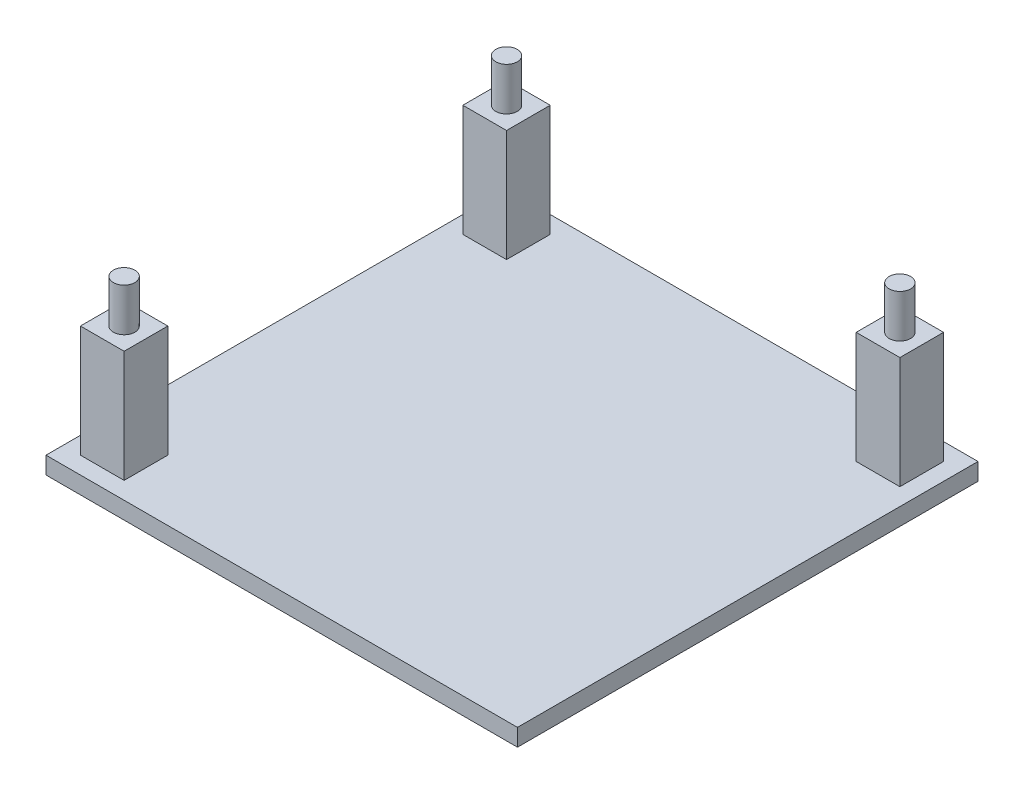
from build123d import *

# Parameters (mm, degrees)
SKETCH2_W           = 54.8
SKETCH2_H           = 53.53
BOSS_EXTRUDE1_DEPTH = 2
SKETCH3_W           = 5.08
SKETCH3_H           = 5.08
BOSS_EXTRUDE2_DEPTH = 13
SKETCH6_R           = 1.25
BOSS_EXTRUDE3_DEPTH = 5


with BuildPart() as part:
    # Sketch2 → Boss-Extrude1 (new body)
    with BuildSketch(Plane(origin=(0, 0, 0), x_dir=(1, 0, 0), z_dir=(0, 1, 0))):
        Rectangle(SKETCH2_W, SKETCH2_H)
    extrude(amount=BOSS_EXTRUDE1_DEPTH)

    # Sketch3 → Boss-Extrude2 (add)
    with BuildSketch(Plane(origin=(0, 2, 0), x_dir=(1, 0, 0), z_dir=(0, 1, 0))):
        with Locations((-22.86, 22.225)):
            Rectangle(SKETCH3_W, SKETCH3_H)
        with Locations((22.86, 22.225)):
            Rectangle(SKETCH3_W, SKETCH3_H)
        with Locations((-22.86, -22.225)):
            Rectangle(SKETCH3_W, SKETCH3_H)
    extrude(amount=BOSS_EXTRUDE2_DEPTH)

    # Sketch6 → Boss-Extrude3 (add)
    with BuildSketch(Plane(origin=(0, 15, 0), x_dir=(1, 0, 0), z_dir=(0, 1, 0))):
        with Locations((-22.86, 22.225)):
            Circle(SKETCH6_R)
        with Locations((22.86, 22.225)):
            Circle(SKETCH6_R)
        with Locations((-22.86, -22.225)):
            Circle(SKETCH6_R)
    extrude(amount=BOSS_EXTRUDE3_DEPTH)


solid = part.part
